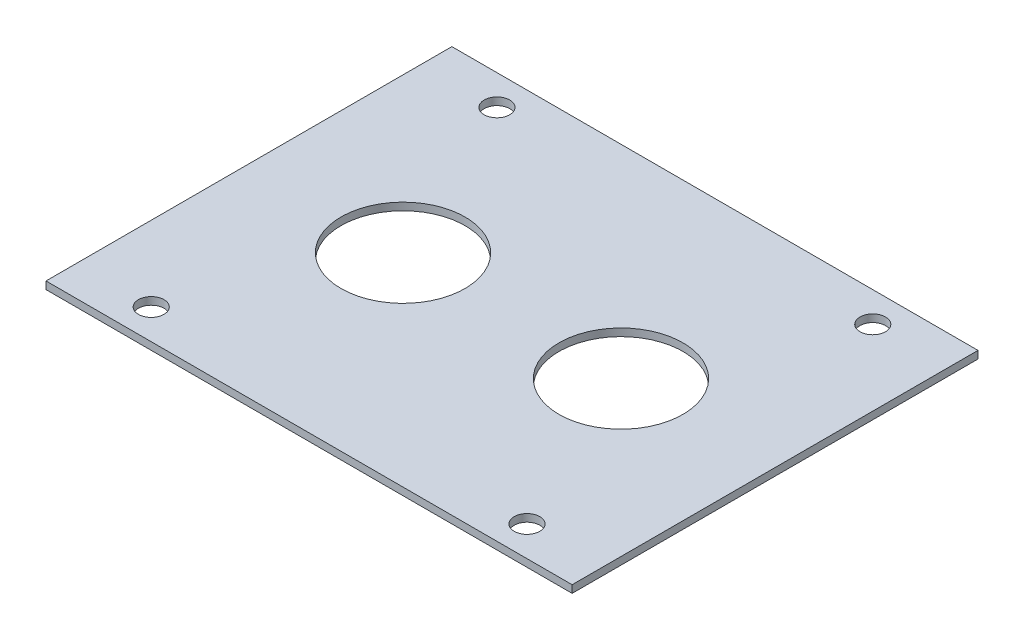
from build123d import *

# Parameters (mm, degrees)
ESQUISSE1_W             = 70
ESQUISSE1_H             = 54
BOSS_EXTRU_1_DEPTH      = 1
ESQUISSE2_R             = 8.25
ENL_V_MAT_EXTRU_1_DEPTH = 10
ESQUISSE4_R             = 8.25
ENL_V_MAT_EXTRU_3_DEPTH = 10
M3_CLEARANCE_HOLE1_D    = 3.4


with BuildPart() as part:
    # Esquisse1 → Boss.-Extru.1 (new body)
    with BuildSketch(Plane(origin=(0, 0, 0), x_dir=(1, 0, 0), z_dir=(0, 1, 0))):
        Rectangle(ESQUISSE1_W, ESQUISSE1_H)
    extrude(amount=BOSS_EXTRU_1_DEPTH)

    # Esquisse2 → Enlèv. mat.-Extru.1 (cut)
    with BuildSketch(Plane(origin=(0, 1, 0), x_dir=(1, 0, 0), z_dir=(0, 1, 0))):
        with Locations((-14.5, 0)):
            Circle(ESQUISSE2_R)
    extrude(amount=-ENL_V_MAT_EXTRU_1_DEPTH, mode=Mode.SUBTRACT)

    # Esquisse4 → Enlèv. mat.-Extru.3 (cut)
    with BuildSketch(Plane(origin=(0, 1, 0), x_dir=(1, 0, 0), z_dir=(0, 1, 0))):
        with Locations((14.5, 0)):
            Circle(ESQUISSE4_R)
    extrude(amount=-ENL_V_MAT_EXTRU_3_DEPTH, mode=Mode.SUBTRACT)

    # M3 Clearance Hole1 (through all)
    with Locations(Plane(origin=(0, 1, 0), x_dir=(1, 0, 0), z_dir=(0, 1, 0))):
        with Locations((-25, -23), (25, -23), (25, 23), (-25, 23)):
            Hole(M3_CLEARANCE_HOLE1_D / 2)


solid = part.part
